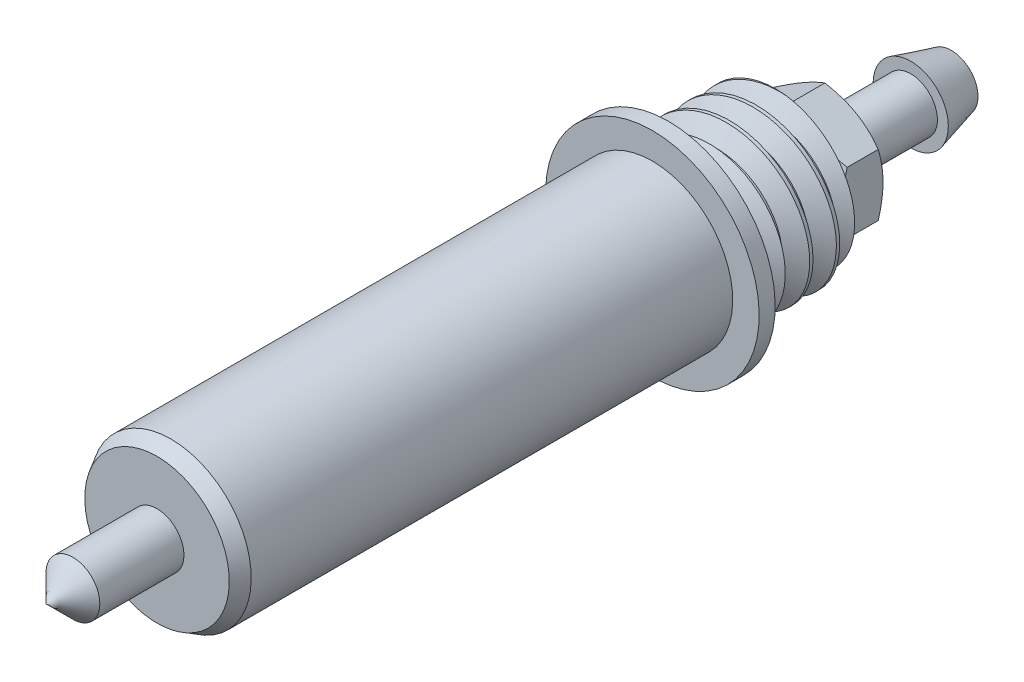
from build123d import *

# Parameters (mm, degrees)
SKETCH4_W           = 0.47625
SKETCH4_H           = 1.449407664
SKETCH6_R           = 0.79375
BOSS_EXTRUDE1_DEPTH = 1.2065
CUT_SWEEP1_PITCH    = 0.79375


with BuildPart() as part:
    # Sketch2 → Revolve1 (revolve)
    with BuildSketch(Plane(origin=(0, 0, 0), x_dir=(0, 0, -1), z_dir=(1, 0, 0))):
        Polygon((-6.985, 0.8001), (-6.985, 2.14884), (-6.571455549, 2.3876), (7.747, 2.3876), (7.747, 1.725592336), (9.017, 1.725592336), (9.413875, 2.413), (11.414125, 2.413), (11.811, 1.725592336), (11.811, 1.322367336), (7.343775, 1.322367336), (7.343775, 1.984375), (-6.581775, 1.984375), (-6.581775, 0.8001), align=None)
    revolve(axis=Axis((0, 0, -16.637), (0, 0, 1)))


with BuildPart() as body_2:
    # Sketch3 → Revolve2 (revolve)
    with BuildSketch(Plane(origin=(0, 0, 0), x_dir=(0, 0, -1), z_dir=(1, 0, 0))):
        Polygon((-10.287, 0), (-9.4869, 0.8001), (-6.985, 0.8001), (-0.635, 0.8001), (-0.635, 1.984375), (3.1242, 1.984375), (3.1242, 0), align=None)
    revolve(axis=Axis((0, 0, -3.1242), (0, 0, 1)))


with BuildPart() as body_3:
    # Sketch4 → Revolve3 (revolve)
    with BuildSketch(Plane(origin=(0, 0, 0), x_dir=(0, 0, -1), z_dir=(1, 0, 0))):
        with Locations((7.985125, 2.450296168)):
            Rectangle(SKETCH4_W, SKETCH4_H)
    revolve(axis=Axis((0, 0, -16.637), (0, 0, 1)))


with BuildPart() as body_4:
    # Sketch5 → Revolve4 (revolve)
    with BuildSketch(Plane(origin=(0, 0, 0), x_dir=(0, 0, -1), z_dir=(1, 0, 0)), mode=Mode.PRIVATE) as revolve4_sk:
        Polygon((11.811, 0.396875), (11.811, 1.5875), (13.0175, 1.5875), (13.0175, 0.79375), (15.4305, 0.79375), (15.4305, 1.117030701), (16.637, 0.79375), (16.637, 0.396875), align=None)
    revolve(revolve4_sk.sketch.rotate(Axis((0, 0, -13.0175), (0, 0, -1)), 180), axis=Axis((0, 0, -13.0175), (0, 0, -1)))

    # Sketch6 → Boss-Extrude1 (add)
    with BuildSketch(Plane(origin=(0, 0, -13.0175), x_dir=(-1, 0, 0), z_dir=(0, 0, -1))):
        Polygon((0, 1.833087105), (-1.5875, 0.916543552), (-1.5875, -0.916543552), (0, -1.833087105), (1.5875, -0.916543552), (1.5875, 0.916543552), align=None)
        with Locations(Location((0, 0, 0), (0, 0, 270))):
            Circle(SKETCH6_R, mode=Mode.SUBTRACT)
    extrude(amount=-BOSS_EXTRUDE1_DEPTH)

    # Sketch7 → Cut-Revolve1 (revolve, cut)
    with BuildSketch(Plane(origin=(0, 0, 0), x_dir=(0, 0, -1), z_dir=(1, 0, 0))):
        Polygon((11.811, 1.5875), (11.952789781, 1.833087105), (11.811, 1.833087105), align=None)
        Polygon((12.875710219, 1.833087105), (13.0175, 1.833087105), (13.0175, 1.5875), align=None)
    revolve(axis=Axis((0, 0, -16.637), (0, 0, 1)), mode=Mode.SUBTRACT)


with BuildPart() as body_5:
    # Split1: the piece on the far side of the plane
    add(part.part)
    split(bisect_by=Plane.XY.offset(-9.017), keep=Keep.BOTTOM)

    # Cut-Sweep1: the profile of Sketch9 screwed along a right-hand helix of 4.52 turns, 8 arcs to a turn; built about Z, then put on its axis
    cut_sweep1_z = Axis((0, 0, 0), (0, 0, 1))
    cut_sweep1_corners = [(1.897444252, 0, -0.396875), (1.897444252, 0, -0.29765625), (2.498925958, 0, 0.049609375), (2.455962979, 0, -0.719335937)]
    with BuildLine(mode=Mode.PRIVATE) as cut_sweep1_profile:
        Line(cut_sweep1_corners[0], cut_sweep1_corners[1])
        Line(cut_sweep1_corners[1], cut_sweep1_corners[2])
        Line(cut_sweep1_corners[2], cut_sweep1_corners[3])
        Line(cut_sweep1_corners[3], cut_sweep1_corners[0])
    cut_sweep1_cap = Face(cut_sweep1_profile.wire())
    cut_sweep1_turn_angles = [0, 22.5, 45, 67.5, 90, 112.5, 135, 157.5, 180, 202.5, 225, 247.5, 270, 292.5, 315, 337.5, 360]
    cut_sweep1_turn_weights = [1, 0.9238795325112867, 1, 0.9238795325112867, 1, 0.9238795325112867, 1, 0.9238795325112867, 1, 0.9238795325112867, 1, 0.9238795325112867, 1, 0.9238795325112867, 1, 0.9238795325112867, 1]
    cut_sweep1_turn_rails = [Edge.make_bspline([Vector(p[0], p[1], 0).rotate(cut_sweep1_z, cut_sweep1_turn_angles[k]) / cut_sweep1_turn_weights[k] + Vector(0, 0, p[2] + CUT_SWEEP1_PITCH * cut_sweep1_turn_angles[k] / 360) for k in range(17)], [0, 0, 0, 1, 1, 2, 2, 3, 3, 4, 4, 5, 5, 6, 6, 7, 7, 8, 8, 8], 2, cut_sweep1_turn_weights) for p in cut_sweep1_corners]
    cut_sweep1_turn_sides = [Face.make_surface_from_curves(cut_sweep1_turn_rails[p[0]], cut_sweep1_turn_rails[p[1]]) for p in [(0, 1), (1, 2), (2, 3), (3, 0)]]
    cut_sweep1_last_angles = [1440, 1462.5, 1485, 1507.5, 1530, 1552.5, 1575, 1597.5, 1620, 1623.6, 1627.2]
    cut_sweep1_last_weights = [1, 0.9238795325112867, 1, 0.9238795325112867, 1, 0.9238795325112867, 1, 0.9238795325112867, 1, 0.99802672842827, 1]
    cut_sweep1_last_rails = [Edge.make_bspline([Vector(p[0], p[1], 0).rotate(cut_sweep1_z, cut_sweep1_last_angles[k]) / cut_sweep1_last_weights[k] + Vector(0, 0, p[2] + CUT_SWEEP1_PITCH * cut_sweep1_last_angles[k] / 360) for k in range(11)], [0, 0, 0, 1, 1, 2, 2, 3, 3, 4, 4, 5, 5, 5], 2, cut_sweep1_last_weights) for p in cut_sweep1_corners]
    cut_sweep1_last_sides = [Face.make_surface_from_curves(cut_sweep1_last_rails[p[0]], cut_sweep1_last_rails[p[1]]) for p in [(0, 1), (1, 2), (2, 3), (3, 0)]]
    cut_sweep1 = Plane(origin=(0, 0, -9.017), x_dir=(0, 1, 0), z_dir=(0, 0, -1)) * Solid(Shell([*[p.moved(Location((0, 0, CUT_SWEEP1_PITCH * i))) for i in range(4) for p in cut_sweep1_turn_sides], *cut_sweep1_last_sides, cut_sweep1_cap, cut_sweep1_cap.rotate(cut_sweep1_z, 1627.2).moved(Location((0, 0, CUT_SWEEP1_PITCH * 1627.2 / 360)))]))
    add(cut_sweep1, mode=Mode.SUBTRACT)


with BuildPart() as part_1:
    add(part.part)

    # Split1
    split(bisect_by=Plane.XY.offset(-9.017), keep=Keep.TOP)

    # Combine1: union body 5
    add(body_5.part)


solid = Compound([body_2.part, body_3.part, body_4.part, part_1.part])
